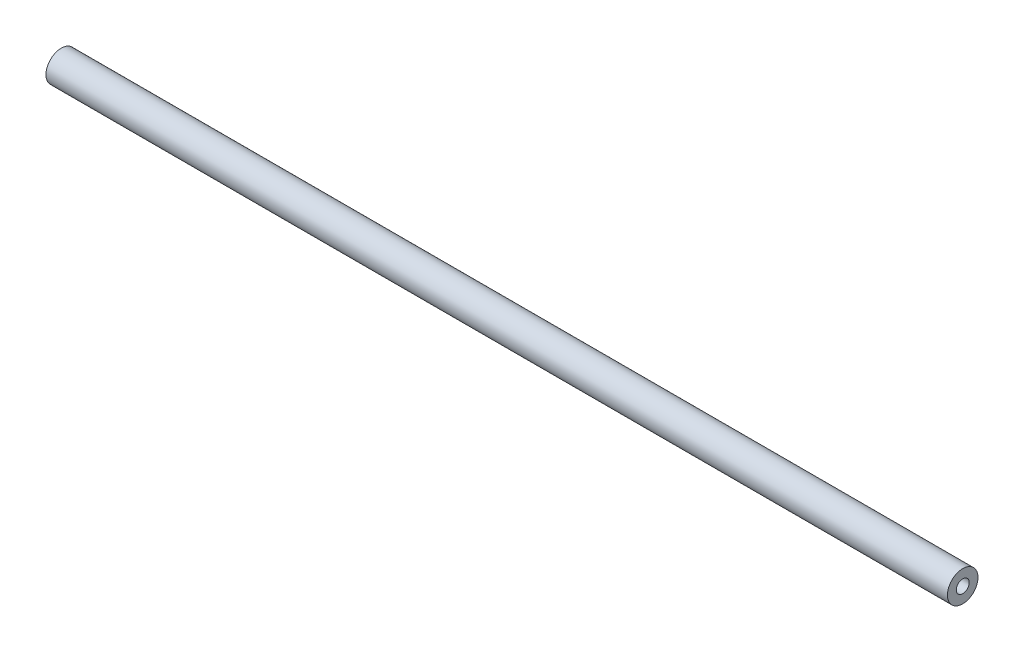
from build123d import *

# Parameters (mm, degrees)
SKETCH1_R                            = 4.7625
BOSS_EXTRUDE1_DEPTH                  = 140.49375
F_10_32_TAPPED_HOLE1_D               = 4.0386
F_10_32_TAPPED_HOLE1_DEPTH           = 12.02944
F_10_32_TAPPED_HOLE1_TIP             = 1.213317848
F_10_32_TAPPED_HOLE1_ON_FACE_2_D     = 4.0386
F_10_32_TAPPED_HOLE1_ON_FACE_2_DEPTH = 12.02944
F_10_32_TAPPED_HOLE1_ON_FACE_2_TIP   = 1.213317848


with BuildPart() as part:
    # Sketch1 → Boss-Extrude1 (new, symmetric)
    with BuildSketch(Plane(origin=(0, 0, 0), x_dir=(0, 0, -1), z_dir=(1, 0, 0))):
        Circle(SKETCH1_R)
    extrude(amount=BOSS_EXTRUDE1_DEPTH, both=True)

    # #10-32 Tapped Hole1
    with Locations(Plane(origin=(140.49375, 0, 0), x_dir=(0, 0, 1), z_dir=(1, 0, 0))):
        with Locations((0, 0)):
            Hole(F_10_32_TAPPED_HOLE1_D / 2, depth=F_10_32_TAPPED_HOLE1_DEPTH)
            with Locations((0, 0, -(F_10_32_TAPPED_HOLE1_DEPTH + F_10_32_TAPPED_HOLE1_TIP / 2))):  # 118° drill point
                Cone(0, F_10_32_TAPPED_HOLE1_D / 2, F_10_32_TAPPED_HOLE1_TIP, mode=Mode.SUBTRACT)

    # #10-32 Tapped Hole1 on face 2
    with Locations(Plane(origin=(-140.49375, 0, 0), x_dir=(0, 0, -1), z_dir=(-1, 0, 0))):
        with Locations((0, 0)):
            Hole(F_10_32_TAPPED_HOLE1_ON_FACE_2_D / 2, depth=F_10_32_TAPPED_HOLE1_ON_FACE_2_DEPTH)
            with Locations((0, 0, -(F_10_32_TAPPED_HOLE1_ON_FACE_2_DEPTH + F_10_32_TAPPED_HOLE1_ON_FACE_2_TIP / 2))):  # 118° drill point
                Cone(0, F_10_32_TAPPED_HOLE1_ON_FACE_2_D / 2, F_10_32_TAPPED_HOLE1_ON_FACE_2_TIP, mode=Mode.SUBTRACT)


solid = part.part
